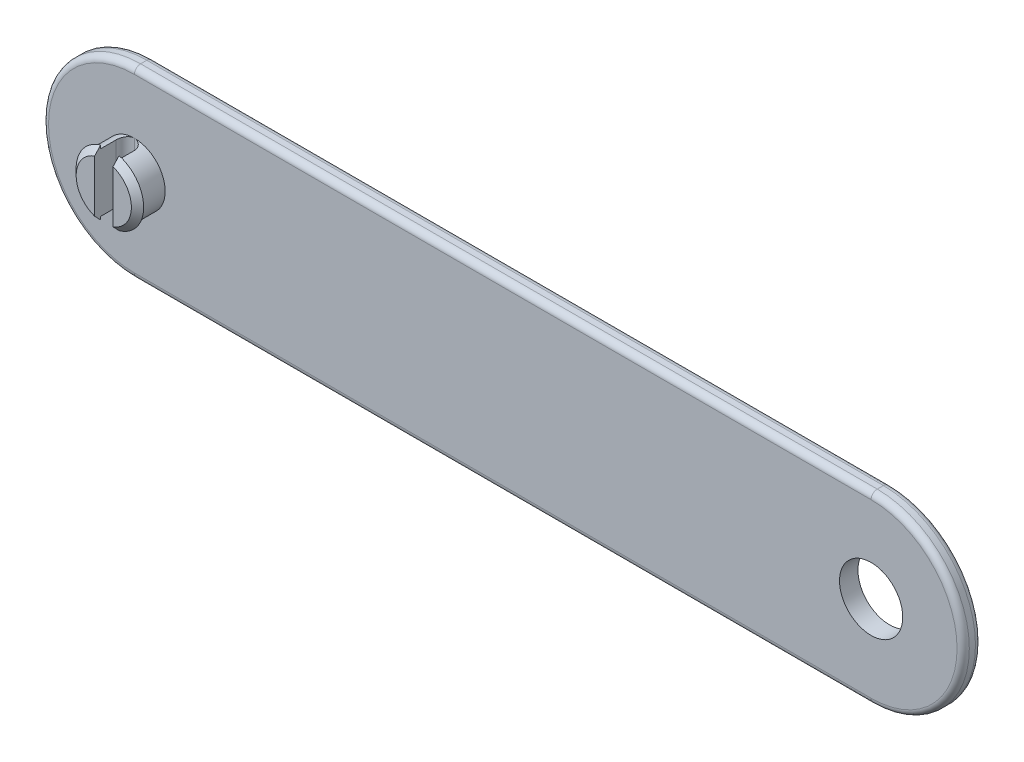
from build123d import *

# Parameters (mm, degrees)
EXTRUDE_1_DEPTH     = 3
EXTRUDE_2_DEPTH     = 4
EXTRUDE_3_DEPTH     = 1
CHAMFER_1_SIZE      = 1
SKETCH_1_3_R        = 5.15
CUT_EXTRUDE_1_DEPTH = 5
FILLET_1_R          = 1.5
FILLET_2_R          = 1


with BuildPart() as part:
    # 草图1 → 凸台-拉伸1 (new body)
    with BuildSketch(Plane.XY):
        with BuildLine():
            Line((0, 15), (120, 15))
            ThreePointArc((120, 15), (135, 0), (120, -15))
            Line((120, -15), (0, -15))
            ThreePointArc((0, -15), (-15, 0), (0, 15))
        make_face()
    extrude(amount=EXTRUDE_1_DEPTH)

    # 草图2 → 凸台-拉伸2 (add)
    with BuildSketch(Plane.XY.offset(3)):
        with BuildLine():
            Line((-1.5, 4.769696007), (-1.5, -4.769696007))
            ThreePointArc((-1.5, -4.769696007), (-5, 0), (-1.5, 4.769696007))
        make_face()
        with BuildLine():
            Line((1.5, 4.769696007), (1.5, -4.769696007))
            ThreePointArc((1.5, -4.769696007), (5, 0), (1.5, 4.769696007))
        make_face()
    extrude(amount=EXTRUDE_2_DEPTH)

    # 草图5 → 凸台-拉伸3 (add)
    with BuildSketch(Plane.XY.offset(7)):
        with BuildLine():
            Line((-1.5, 5.291502622), (-1.5, -5.291502622))
            ThreePointArc((-1.5, -5.291502622), (-5.5, 0), (-1.5, 5.291502622))
        make_face()
        with BuildLine():
            Line((1.5, 5.291502622), (1.5, -5.291502622))
            ThreePointArc((1.5, -5.291502622), (5.5, 0), (1.5, 5.291502622))
        make_face()
    extrude(amount=EXTRUDE_3_DEPTH)

    # 倒角1
    chamfer_1_edges = [part.edges().sort_by_distance(p)[0] for p in [
        (5.5, 0, 8),
        (-5.5, 0, 8),
    ]]
    chamfer(chamfer_1_edges, length=CHAMFER_1_SIZE - 0.0001)  # a hair under: the kernel refuses the full size

    # 草图1<3> → 切除-拉伸1 (cut)
    with BuildSketch(Plane.XY):
        with Locations((120, 0)):
            Circle(SKETCH_1_3_R)
    extrude(amount=CUT_EXTRUDE_1_DEPTH, mode=Mode.SUBTRACT)

    # 圆角1
    fillet_1_edges = [part.edges().sort_by_distance(p)[0] for p in [
        (-1.5, 0, 3),
        (1.5, 0, 3),
    ]]
    fillet(fillet_1_edges, radius=FILLET_1_R - 0.0001)  # a hair under: the kernel refuses the full size

    # 圆角2
    fillet_2_edges = [part.edges().sort_by_distance(p)[0] for p in [
        (135, 0, 3),
        (60, 15, 3),
        (-15, 0, 3),
        (60, 15, 0),
        (135, 0, 0),
        (60, -15, 0),
        (-15, 0, 0),
        (60, -15, 3),
    ]]
    fillet(fillet_2_edges, radius=FILLET_2_R)


solid = part.part
